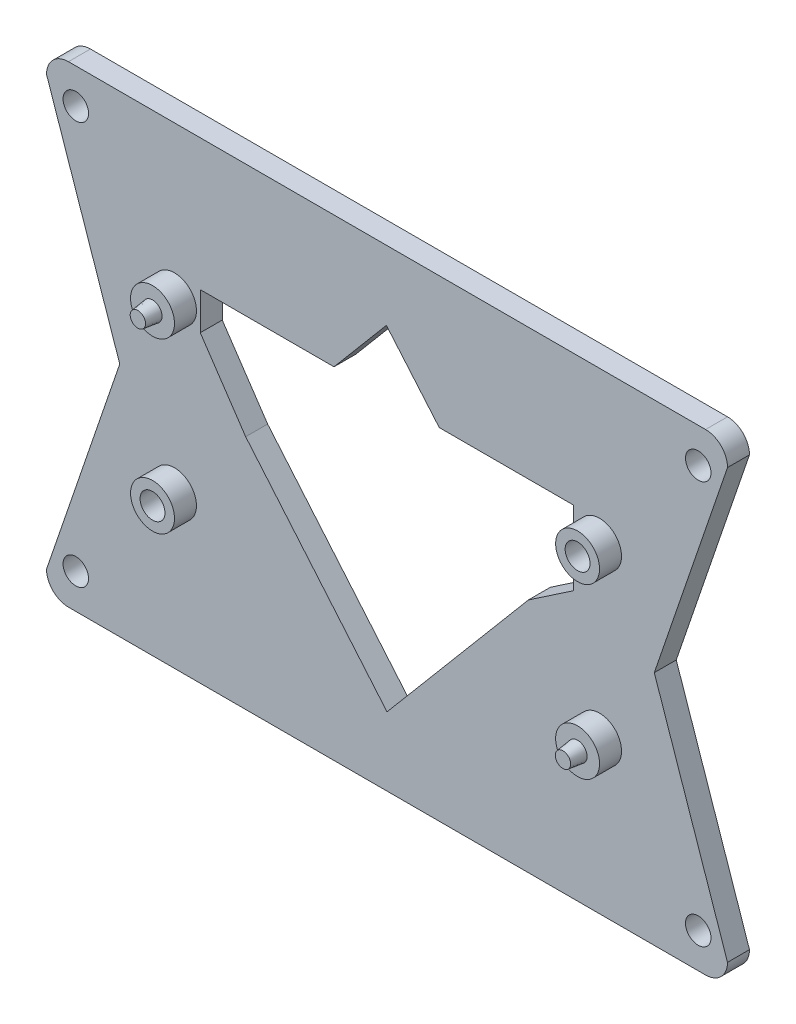
from build123d import *
from OCP.BRepFilletAPI import BRepFilletAPI_MakeChamfer

# Parameters (mm, degrees)
SKETCH2_W           = 93
SKETCH2_H           = 64.518072289
SKETCH2_R           = 1.740963855
BOSS_EXTRUDE1_DEPTH = 3
FILLET1_R           = 3
SKETCH3_R           = 3
SKETCH3_R_2         = 1.325
BOSS_EXTRUDE2_DEPTH = 3
SKETCH4_R           = 1.3
BOSS_EXTRUDE3_DEPTH = 2
SKETCH5_R           = 1.7
CUT_EXTRUDE1_DEPTH  = 11
CHAMFER1_SIZE       = 2
CHAMFER1_SIZE_2     = 0.25
CUT_EXTRUDE2_DEPTH  = 11
CUT_EXTRUDE3_DEPTH  = 11
SKETCH8_R           = 3
SKETCH8_R_2         = 1.7
CUT_EXTRUDE4_DEPTH  = 1.5
CUT_EXTRUDE5_DEPTH  = 1.5
CUT_EXTRUDE6_DEPTH  = 3


with BuildPart() as part:
    # Sketch2 → Boss-Extrude1 (new body)
    with BuildSketch(Plane.XY):
        with Locations((46.5, 32.259036145)):
            Rectangle(SKETCH2_W, SKETCH2_H)
        with Locations((89, 4.759036145)):
            Circle(SKETCH2_R, mode=Mode.SUBTRACT)
        with Locations((89, 59.759036145)):
            Circle(SKETCH2_R, mode=Mode.SUBTRACT)
        with Locations((4, 59.759036145)):
            Circle(SKETCH2_R, mode=Mode.SUBTRACT)
        with Locations((4, 4.759036145)):
            Circle(SKETCH2_R, mode=Mode.SUBTRACT)
    extrude(amount=BOSS_EXTRUDE1_DEPTH)

    # Fillet1
    fillet1_edges = [part.edges().sort_by_distance(p)[0] for p in [
        (0, 0, 1.5),
        (0, 64.518072289, 1.5),
        (93, 64.518072289, 1.5),
        (93, 0, 1.5),
    ]]
    fillet(fillet1_edges, radius=FILLET1_R)

    # Sketch3 → Boss-Extrude2 (add)
    # profile 1 of 8: a face of its own
    with BuildSketch(Plane.XY.offset(3)):
        with Locations((17.475, 43.784036145)):
            Circle(SKETCH3_R)
        with Locations((17.475, 43.784036145)):
            Circle(SKETCH3_R_2, mode=Mode.SUBTRACT)
    # profile 2 of 8: a face of its own
    with BuildSketch(Plane.XY.offset(3)):
        with Locations((17.475, 20.734036145)):
            Circle(SKETCH3_R)
        with Locations((17.475, 20.734036145)):
            Circle(SKETCH3_R_2, mode=Mode.SUBTRACT)
    # profile 3 of 8: a face of its own
    with BuildSketch(Plane.XY.offset(3)):
        with Locations((17.475, 20.734036145)):
            Circle(SKETCH3_R_2)
    # profile 4 of 8: a face of its own
    with BuildSketch(Plane.XY.offset(3)):
        with Locations((75.525, 43.784036145)):
            Circle(SKETCH3_R)
        with Locations((75.525, 43.784036145)):
            Circle(SKETCH3_R_2, mode=Mode.SUBTRACT)
    # profile 5 of 8: a face of its own
    with BuildSketch(Plane.XY.offset(3)):
        with Locations((75.525, 43.784036145)):
            Circle(SKETCH3_R_2)
    # profile 6 of 8: a face of its own
    with BuildSketch(Plane.XY.offset(3)):
        with Locations((75.525, 20.734036145)):
            Circle(SKETCH3_R)
        with Locations((75.525, 20.734036145)):
            Circle(SKETCH3_R_2, mode=Mode.SUBTRACT)
    # profile 7 of 8: a face of its own
    with BuildSketch(Plane.XY.offset(3)):
        with Locations((75.525, 20.734036145)):
            Circle(SKETCH3_R_2)
    # profile 8 of 8: a face of its own
    with BuildSketch(Plane.XY.offset(3)):
        with Locations((17.475, 43.784036145)):
            Circle(SKETCH3_R_2)
    extrude(amount=BOSS_EXTRUDE2_DEPTH)

    # Sketch4 → Boss-Extrude3 (add)
    with BuildSketch(Plane.XY.offset(6)):
        with Locations((75.525, 20.734036145)):
            Circle(SKETCH4_R)
        with Locations((17.475, 43.784036145)):
            Circle(SKETCH4_R)
    extrude(amount=BOSS_EXTRUDE3_DEPTH)

    # Sketch5 → Cut-Extrude1 (cut)
    with BuildSketch(Plane.XY.offset(6)):
        with Locations((17.475, 20.734036145)):
            Circle(SKETCH5_R)
        with Locations((75.525, 43.784036145)):
            Circle(SKETCH5_R)
    extrude(amount=-CUT_EXTRUDE1_DEPTH, mode=Mode.SUBTRACT)

    # Chamfer1
    chamfer1_edges_1 = [part.edges().sort_by_distance(p)[0] for p in [
        (74.225, 20.734036145, 8),
    ]]
    chamfer1_side_1 = [part.faces().sort_by_distance(p)[0] for p in [
        (74.225, 20.734036145, 7.995),
    ]]
    chamfer1_edges_2 = [part.edges().sort_by_distance(p)[0] for p in [
        (16.175, 43.784036145, 8),
    ]]
    chamfer1_side_2 = [part.faces().sort_by_distance(p)[0] for p in [
        (16.175, 43.784036145, 7.995),
    ]]
    chamfer1 = BRepFilletAPI_MakeChamfer(part.part.solid().wrapped)
    for e in chamfer1_edges_1:
        chamfer1.Add(CHAMFER1_SIZE - 0.0001, CHAMFER1_SIZE_2 - 0.0001, e.wrapped, chamfer1_side_1[0].wrapped)
    for e in chamfer1_edges_2:
        chamfer1.Add(CHAMFER1_SIZE - 0.0001, CHAMFER1_SIZE_2 - 0.0001, e.wrapped, chamfer1_side_2[0].wrapped)
    add(Compound.cast(chamfer1.Shape()), mode=Mode.REPLACE)  # a hair under: the kernel refuses the full size

    # Sketch6 → Cut-Extrude2 (cut)
    with BuildSketch(Plane.XY.offset(3)):
        Polygon((46.41475966, 55.04295344), (27.196400626, 32.259036144), (46.5, 9.374063974), (65.803599374, 32.259036145), align=None)
    extrude(amount=-CUT_EXTRUDE2_DEPTH, mode=Mode.SUBTRACT)

    # Sketch7 → Cut-Extrude3 (cut)
    with BuildSketch(Plane.XY.offset(3)):
        Polygon((21, 46.559036145), (21, 41.459036145), (66.9, 41.459036145), (66.9, 36.459036145), (72, 36.459036145), (72, 46.559036145), align=None)
    extrude(amount=-CUT_EXTRUDE3_DEPTH, mode=Mode.SUBTRACT)

    # Sketch8 → Cut-Extrude4 (cut)
    # profile 1 of 4: a face of its own
    with BuildSketch(Plane(origin=(0, 0, 0), x_dir=(-1, 0, 0), z_dir=(0, 0, -1))):
        with Locations(Location((-75.525, 43.784036145, 0), (0, 0, 180))):
            Circle(SKETCH8_R)
        with Locations(Location((-75.525, 43.784036145, 0), (0, 0, 180))):
            Circle(SKETCH8_R_2, mode=Mode.SUBTRACT)
    # profile 2 of 4: a face of its own
    with BuildSketch(Plane(origin=(0, 0, 0), x_dir=(-1, 0, 0), z_dir=(0, 0, -1))):
        with Locations(Location((-17.475, 20.734036145, 0), (0, 0, 180))):
            Circle(SKETCH8_R)
        with Locations(Location((-17.475, 20.734036145, 0), (0, 0, 180))):
            Circle(SKETCH8_R_2, mode=Mode.SUBTRACT)
    # profile 3 of 4: a face of its own
    with BuildSketch(Plane(origin=(0, 0, 0), x_dir=(-1, 0, 0), z_dir=(0, 0, -1))):
        Polygon((-72, 36.459036145), (-65.803599374, 32.259036145), (-57.974509975, 41.459036145), (-66.9, 41.459036145), align=None)
    # profile 4 of 4: a face of its own
    with BuildSketch(Plane(origin=(0, 0, 0), x_dir=(-1, 0, 0), z_dir=(0, 0, -1))):
        Polygon((-27.196400626, 32.259036144), (-21, 41.459036145), (-34.956651017, 41.459036145), align=None)
    extrude(amount=-CUT_EXTRUDE4_DEPTH, mode=Mode.SUBTRACT)

    # Sketch9 → Cut-Extrude5 (cut)
    with BuildSketch(Plane(origin=(0, 0, 1.5), x_dir=(-1, 0, 0), z_dir=(0, 0, -1))):
        Polygon((-66.9, 36.459036145), (-72, 36.459036145), (-65.803599374, 32.259036145), (-57.974509975, 41.459036145), (-66.9, 41.459036145), align=None)
        Polygon((-34.956651017, 41.459036145), (-27.196400626, 32.259036144), (-21, 41.459036145), align=None)
    extrude(amount=-CUT_EXTRUDE5_DEPTH, mode=Mode.SUBTRACT)

    # Sketch10 → Cut-Extrude6 (cut)
    with BuildSketch(Plane.XY.offset(3)):
        Polygon((0, 61.518072289), (0, 32.259036145), (10, 32.259036145), align=None)
        Polygon((10, 32.259036145), (0, 32.259036145), (0, 3), align=None)
        Polygon((93, 32.259036145), (93, 61.518072289), (83, 32.259036145), align=None)
        Polygon((83, 32.259036145), (93, 3), (93, 32.259036145), align=None)
    extrude(amount=-CUT_EXTRUDE6_DEPTH, mode=Mode.SUBTRACT)


solid = part.part
